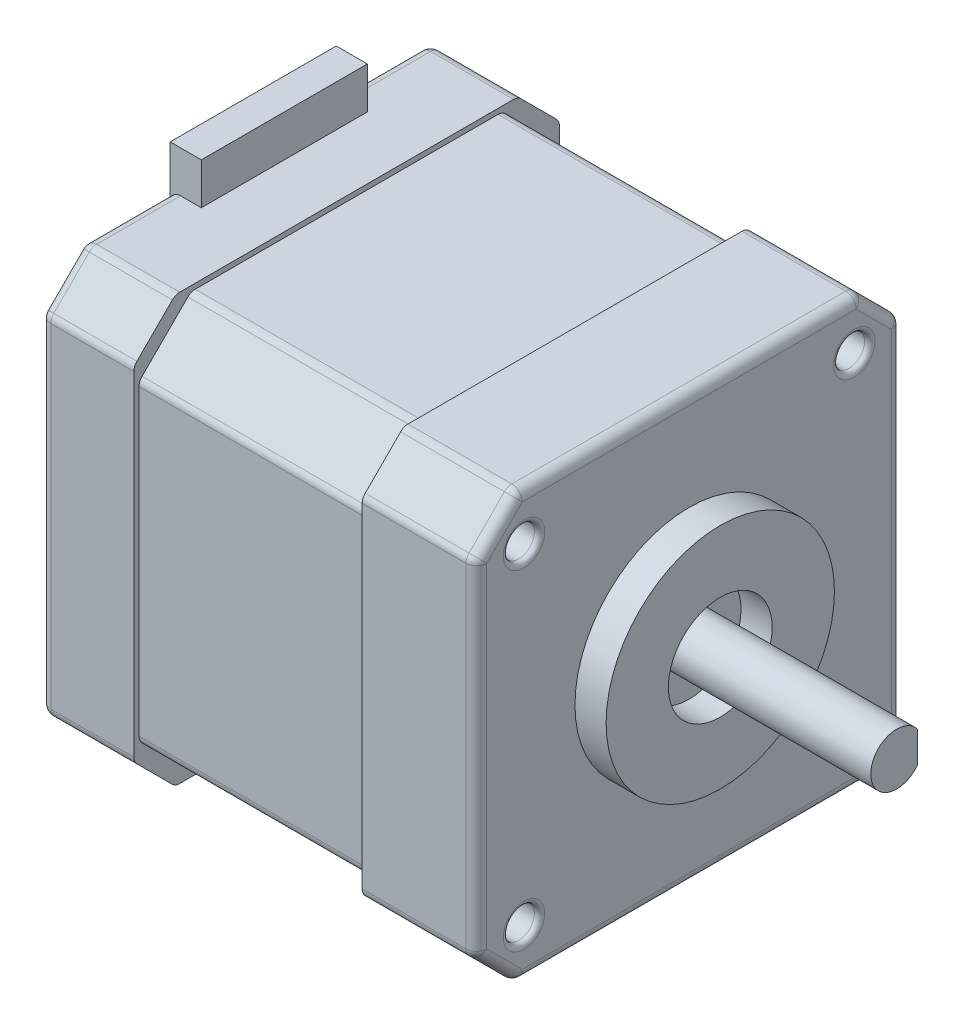
from build123d import *

# Parameters (mm, degrees)
BOSS_EXTRUDE1_DEPTH      = 42
SKETCH2_R                = 11
BOSS_EXTRUDE2_DEPTH      = 3
SKETCH3_R                = 5
CUT_EXTRUDE1_DEPTH       = 3
CUT_EXTRUDE2_START       = -3
SKETCH4_R                = 5
SKETCH4_R_2              = 3.5
CUT_EXTRUDE2_DEPTH       = 3
FILLET1_R                = 1
SKETCH6_OUTSIDE_W        = 57.68
SKETCH6_OUTSIDE_H        = 57.68
CUT_EXTRUDE3_DEPTH       = 22
FILLET2_R                = 1
SKETCH7_R                = 2.5
BOSS_EXTRUDE3_DEPTH      = 20
BOSS_EXTRUDE4_START      = 3
SKETCH8_R                = 2.5
BOSS_EXTRUDE4_DEPTH      = 3
BOSS_EXTRUDE5_DEPTH      = 4
BOSS_EXTRUDE5_DEPTH_BACK = 3
SKETCH9_W                = 3
SKETCH9_H                = 16
SKETCH10_R               = 1.5
CUT_EXTRUDE4_DEPTH       = 4
FILLET3_R                = 0.5
SKETCH11_W               = 4.617268101
SKETCH11_H               = 7.165509353
CUT_EXTRUDE5_DEPTH       = 16
FILLET4_R                = 0.5


with BuildPart() as part:
    # Sketch1 → Boss-Extrude1 (new body)
    with BuildSketch(Plane(origin=(0, 0, 0), x_dir=(0, 0, -1), z_dir=(1, 0, 0))):
        Polygon((16.5, 20.5), (20.5, 16.5), (20.5, -16.5), (16.5, -20.5), (-16.5, -20.5), (-20.5, -16.5), (-20.5, 16.5), (-16.5, 20.5), align=None)
    extrude(amount=BOSS_EXTRUDE1_DEPTH)

    # Sketch2 → Boss-Extrude2 (add)
    with BuildSketch(Plane(origin=(42, 0, 0), x_dir=(0, 0, -1), z_dir=(1, 0, 0))):
        Circle(SKETCH2_R)
    extrude(amount=BOSS_EXTRUDE2_DEPTH)

    # Sketch3 → Cut-Extrude1 (cut)
    with BuildSketch(Plane(origin=(45, 0, 0), x_dir=(0, 0, -1), z_dir=(1, 0, 0))):
        Circle(SKETCH3_R)
    extrude(amount=-CUT_EXTRUDE1_DEPTH, mode=Mode.SUBTRACT)

    # Sketch4 → Cut-Extrude2 (cut)
    with BuildSketch(Plane.ZY.offset(CUT_EXTRUDE2_START)):
        with Locations(Location((0, 0, 0), (0, 0, 180))):
            Circle(SKETCH4_R)
        with Locations((-15.202795796, 15.202795796)):
            Circle(SKETCH4_R_2)
        with Locations((15.202795796, 15.202795796)):
            Circle(SKETCH4_R_2)
        with Locations((15.202795796, -15.202795796)):
            Circle(SKETCH4_R_2)
        with Locations((-15.202795796, -15.202795796)):
            Circle(SKETCH4_R_2)
    extrude(amount=CUT_EXTRUDE2_DEPTH, mode=Mode.SUBTRACT)

    # Fillet1
    fillet1_edges = [part.edges().sort_by_distance(p)[0] for p in [
        (42, 0, 20.5),
        (0, 18.5, 18.5),
        (0, 20.5, 0),
        (42, -18.5, 18.5),
        (21, 20.5, -16.5),
        (21, 16.5, -20.5),
        (21, -16.5, -20.5),
        (21, -20.5, -16.5),
        (21, -20.5, 16.5),
        (21, -16.5, 20.5),
        (21, 16.5, 20.5),
        (21, 20.5, 16.5),
        (42, -20.5, 0),
        (42, 0, -20.5),
        (42, 18.5, -18.5),
        (42, 20.5, 0),
        (42, 18.5, 18.5),
        (0, 18.5, -18.5),
        (0, 0, -20.5),
        (0, -18.5, -18.5),
        (0, -20.5, 0),
        (0, -18.5, 18.5),
        (0, 0, 20.5),
    ]]
    fillet(fillet1_edges, radius=FILLET1_R)

    # Sketch6 outside → Cut-Extrude3 (cut)
    with BuildSketch(Plane.ZY.offset(-9)):
        Rectangle(SKETCH6_OUTSIDE_W, SKETCH6_OUTSIDE_H)
        Polygon((20, 15), (15, 20), (-15, 20), (-20, 15), (-20, -15), (-15, -20), (15, -20), (20, -15), align=None, mode=Mode.SUBTRACT)
    extrude(amount=-CUT_EXTRUDE3_DEPTH, mode=Mode.SUBTRACT)

    # Fillet2
    fillet2_edges = [part.edges().sort_by_distance(p)[0] for p in [
        (20, -15, 20),
        (20, -20, 15),
        (20, -20, -15),
        (20, -15, -20),
        (20, 15, -20),
        (20, 20, -15),
        (20, 20, 15),
        (20, 15, 20),
    ]]
    fillet(fillet2_edges, radius=FILLET2_R)

    # Sketch7 → Boss-Extrude3 (add)
    with BuildSketch(Plane(origin=(42, 0, 0), x_dir=(0, 0, -1), z_dir=(1, 0, 0))):
        Circle(SKETCH7_R)
    extrude(amount=BOSS_EXTRUDE3_DEPTH)

    # Sketch8 → Boss-Extrude4 (add)
    with BuildSketch(Plane.ZY.offset(-3).offset(BOSS_EXTRUDE4_START)):
        with Locations(Location((0, 0, 0), (0, 0, 180))):
            Circle(SKETCH8_R)
    extrude(amount=-BOSS_EXTRUDE4_DEPTH)

    # Sketch9 → Boss-Extrude5 (add, two sides: drawn at the far end of the back side and taken through both)
    with BuildSketch(Plane(origin=(0, 20.5, 0), x_dir=(1, 0, 0), z_dir=(0, 1, 0)).offset(-BOSS_EXTRUDE5_DEPTH_BACK)):
        with Locations((1.5, 0)):
            Rectangle(SKETCH9_W, SKETCH9_H)
    extrude(amount=BOSS_EXTRUDE5_DEPTH + BOSS_EXTRUDE5_DEPTH_BACK)

    # Sketch10 → Cut-Extrude4 (cut)
    with BuildSketch(Plane(origin=(42, 0, 0), x_dir=(0, 0, -1), z_dir=(1, 0, 0))):
        with Locations((-15.909902577, 15.909902577)):
            Circle(SKETCH10_R)
        with Locations((15.909902577, 15.909902577)):
            Circle(SKETCH10_R)
        with Locations((15.909902577, -15.909902577)):
            Circle(SKETCH10_R)
        with Locations((-15.909902577, -15.909902577)):
            Circle(SKETCH10_R)
    extrude(amount=-CUT_EXTRUDE4_DEPTH, mode=Mode.SUBTRACT)

    # Fillet3
    fillet3_edges = [part.edges().sort_by_distance(p)[0] for p in [
        (42, -15.909902577, 17.409902577),
        (42, -15.909902577, -14.409902577),
        (42, 15.909902577, -14.409902577),
        (42, 15.909902577, 17.409902577),
    ]]
    fillet(fillet3_edges, radius=FILLET3_R)

    # Sketch11 → Cut-Extrude5 (cut)
    with BuildSketch(Plane(origin=(62, 0, 0), x_dir=(0, 0, -1), z_dir=(1, 0, 0))):
        with Locations((4.308634051, 0.235343147)):
            Rectangle(SKETCH11_W, SKETCH11_H)
    extrude(amount=-CUT_EXTRUDE5_DEPTH, mode=Mode.SUBTRACT)

    # Fillet4
    fillet4_edges = [part.edges().sort_by_distance(p)[0] for p in [
        (46, 0.790569415, -2.371708245),
    ]]
    fillet(fillet4_edges, radius=FILLET4_R - 0.0001)  # a hair under: the kernel refuses the full size


solid = part.part
